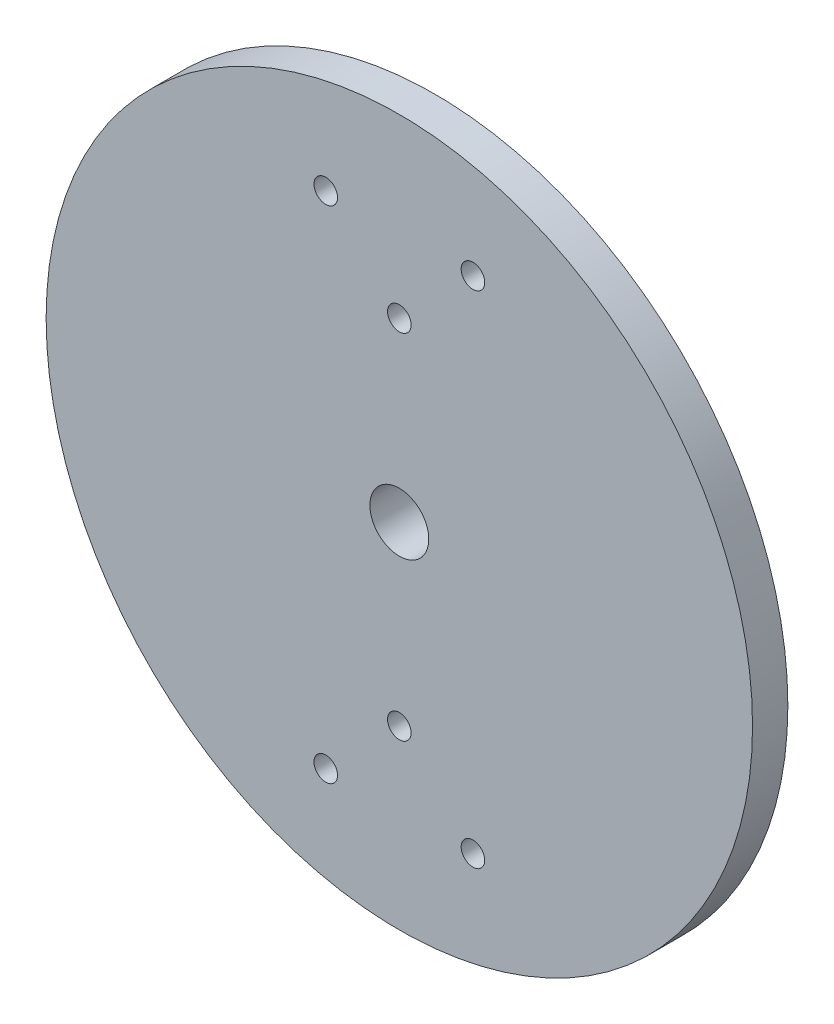
from build123d import *

# Parameters (mm, degrees)
SKETCH1_R           = 76.2
SKETCH1_R_2         = 6.35
BOSS_EXTRUDE1_DEPTH = 7.62
SKETCH2_R           = 35.56
BOSS_EXTRUDE2_DEPTH = 5.08
CUT_EXTRUDE2_START  = -25.4
SKETCH3_R           = 2.54
SKETCH3_R_2         = 6.35
CUT_EXTRUDE2_DEPTH  = 25.4


with BuildPart() as part:
    # Sketch1 → Boss-Extrude1 (new body)
    with BuildSketch(Plane.XY):
        Circle(SKETCH1_R)
        Circle(SKETCH1_R_2, mode=Mode.SUBTRACT)
    extrude(amount=BOSS_EXTRUDE1_DEPTH)

    # Sketch2 → Boss-Extrude2 (add)
    with BuildSketch(Plane(origin=(0, 0, 0), x_dir=(-1, 0, 0), z_dir=(0, 0, -1))):
        Circle(SKETCH2_R)
    extrude(amount=BOSS_EXTRUDE2_DEPTH)

    # Sketch3 → Cut-Extrude2 (cut)
    with BuildSketch(Plane.XY.offset(7.62).offset(CUT_EXTRUDE2_START)):
        with Locations((15.875, -53.975)):
            Circle(SKETCH3_R)
        with Locations((-15.875, -53.975)):
            Circle(SKETCH3_R)
        with Locations((0, -38.1)):
            Circle(SKETCH3_R)
        with Locations((-15.875, 53.975)):
            Circle(SKETCH3_R)
        with Locations((0, 38.1)):
            Circle(SKETCH3_R)
        with Locations((15.875, 53.975)):
            Circle(SKETCH3_R)
        Circle(SKETCH3_R_2)
    extrude(amount=CUT_EXTRUDE2_DEPTH, mode=Mode.SUBTRACT)


solid = part.part
